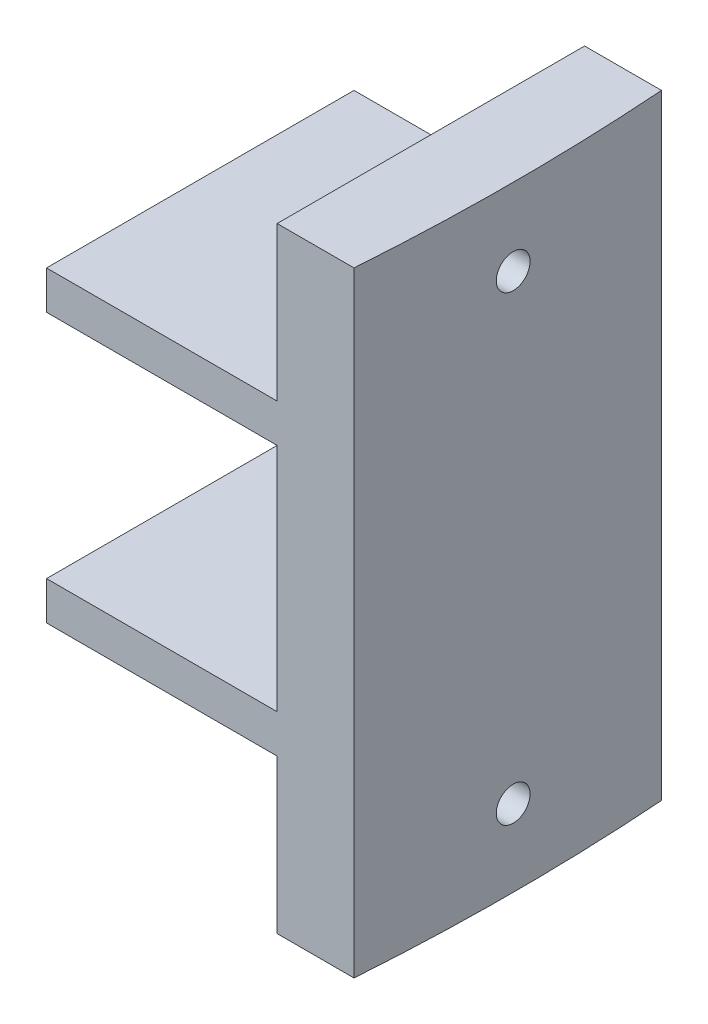
from build123d import *

# Parameters (mm, degrees)
SKETCH1_R                = 1.1303
BOSS_EXTRUDE1_DEPTH      = 12.7
SKETCH2_W                = 9.525
SKETCH2_H                = 9.525
CUT_EXTRUDE1_DEPTH       = 91.696141042
BOSS_EXTRUDE2_DEPTH      = 6.35
BOSS_EXTRUDE2_DEPTH_BACK = 19.05
SKETCH5_R                = 0.6985
CUT_EXTRUDE2_DEPTH       = 23.225


with BuildPart() as part:
    # Sketch1 → Boss-Extrude1 (new body)
    with BuildSketch(Plane(origin=(0, 0, 0), x_dir=(1, 0, 0), z_dir=(0, 1, 0))):
        with BuildLine():
            Line((75.972924278, 6.35), (75.972924278, -6.35))
            Line((75.972924278, -6.35), (88.672924278, -6.35))
            ThreePointArc((88.672924278, -6.35), (88.9, 0), (88.672924278, 6.35))
            Line((88.672924278, 6.35), (75.972924278, 6.35))
        make_face()
        with Locations((82.322924278, 0)):
            Circle(SKETCH1_R, mode=Mode.SUBTRACT)
    extrude(amount=BOSS_EXTRUDE1_DEPTH)

    # Sketch2 → Cut-Extrude1 (cut, through all)
    with BuildSketch(Plane.XY.offset(6.35)):
        with Locations((80.735424278, 6.35)):
            Rectangle(SKETCH2_W, SKETCH2_H)
    extrude(amount=-CUT_EXTRUDE1_DEPTH, mode=Mode.SUBTRACT)

    # Sketch3 → Boss-Extrude2 (add, two sides: drawn at the far end of the back side and taken through both)
    with BuildSketch(Plane(origin=(0, 12.7, 0), x_dir=(1, 0, 0), z_dir=(0, 1, 0)).offset(-BOSS_EXTRUDE2_DEPTH_BACK)):
        with BuildLine():
            Line((85.497924278, -6.35), (88.672924278, -6.35))
            ThreePointArc((88.672924278, -6.35), (88.9, 0), (88.672924278, 6.35))
            Line((88.672924278, 6.35), (85.497924278, 6.35))
            Line((85.497924278, 6.35), (85.497924278, -6.35))
        make_face()
    extrude(amount=BOSS_EXTRUDE2_DEPTH + BOSS_EXTRUDE2_DEPTH_BACK)

    # Sketch5 → Cut-Extrude2 (cut, through all)
    with BuildSketch(Plane.ZY.offset(-85.497924278)):
        with Locations((0, 15.875)):
            Circle(SKETCH5_R)
        with Locations((0, -3.175)):
            Circle(SKETCH5_R)
    extrude(amount=-CUT_EXTRUDE2_DEPTH, mode=Mode.SUBTRACT)


solid = part.part
